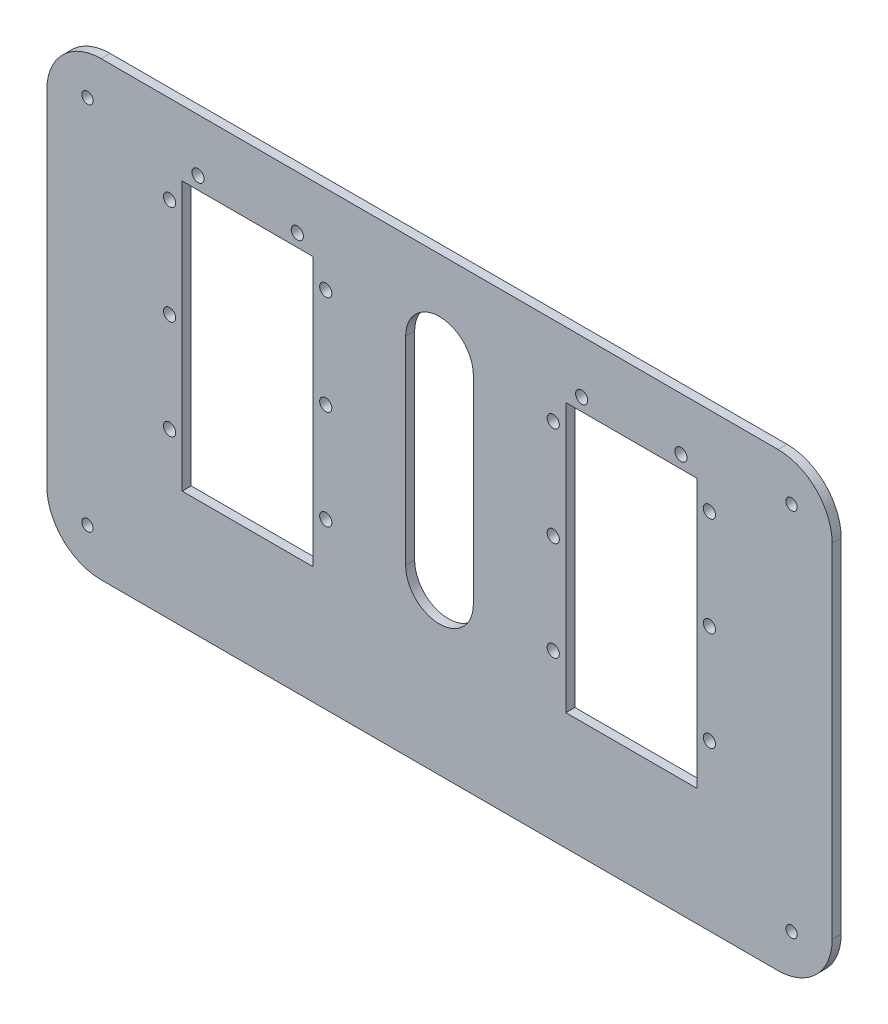
from build123d import *

# Parameters (mm, degrees)
ESBO_O1_W                     = 174
ESBO_O1_H                     = 100
ESBO_O1_R                     = 1.25
RESSALTO_EXTRUS_O1_DEPTH      = 3
FILETE1_R                     = 12
ESBO_O2_R                     = 1.35
ESBO_O2_W                     = 29
ESBO_O2_H                     = 59.5
CORTE_EXTRUS_O1_DEPTH         = 10
CONVERTER_S_LIDO1_OUTLINE_R   = 1.25
CONVERTER_S_LIDO1_OUTLINE_R_2 = 1.35
CONVERTER_S_LIDO1_OUTLINE_W   = 29
CONVERTER_S_LIDO1_OUTLINE_H   = 59.5
CONVERTER_S_LIDO1_DEPTH       = 1


# Read off the part's stored shape, not the designer's step: Converter-Sólido1
with BuildPart() as part:
    # Esboço1 → Ressalto-extrusão1 (new body)
    with BuildSketch(Plane.XY):
        Rectangle(ESBO_O1_W, ESBO_O1_H)
        with Locations((-78, -41)):
            Circle(ESBO_O1_R, mode=Mode.SUBTRACT)
        with Locations((-78, 41)):
            Circle(ESBO_O1_R, mode=Mode.SUBTRACT)
        with Locations((78, 41)):
            Circle(ESBO_O1_R, mode=Mode.SUBTRACT)
        with Locations((78, -41)):
            Circle(ESBO_O1_R, mode=Mode.SUBTRACT)
    extrude(amount=RESSALTO_EXTRUS_O1_DEPTH)

    # Filete1
    filete1_edges = [part.edges().sort_by_distance(p)[0] for p in [
        (87, -50, 1.5),
        (-87, -50, 1.5),
        (-87, 50, 1.5),
        (87, 50, 1.5),
    ]]
    fillet(filete1_edges, radius=FILETE1_R)

    # Esboço2 → Corte-extrusão1 (cut)
    with BuildSketch(Plane.XY.offset(3)):
        with Locations((-59.8, 30.5)):
            Circle(ESBO_O2_R)
        with Locations((-59.8, 8.5)):
            Circle(ESBO_O2_R)
        with Locations((-59.8, -13.5)):
            Circle(ESBO_O2_R)
        with Locations((-25.2, -13.5)):
            Circle(ESBO_O2_R)
        with Locations((-25.2, 8.5)):
            Circle(ESBO_O2_R)
        with Locations((-25.2, 30.5)):
            Circle(ESBO_O2_R)
        with Locations((-53.5, 38.3)):
            Circle(ESBO_O2_R)
        with Locations((-31.5, 38.3)):
            Circle(ESBO_O2_R)
        with Locations((31.5, 38.3)):
            Circle(ESBO_O2_R)
        with Locations((53.5, 38.3)):
            Circle(ESBO_O2_R)
        with Locations((25.2, 30.5)):
            Circle(ESBO_O2_R)
        with Locations((25.2, 8.5)):
            Circle(ESBO_O2_R)
        with Locations((25.2, -13.5)):
            Circle(ESBO_O2_R)
        with Locations((59.8, -13.5)):
            Circle(ESBO_O2_R)
        with Locations((59.8, 8.5)):
            Circle(ESBO_O2_R)
        with Locations((59.8, 30.5)):
            Circle(ESBO_O2_R)
        with Locations((-42.5, 5.75)):
            Rectangle(ESBO_O2_W, ESBO_O2_H)
        with Locations((42.5, 5.75)):
            Rectangle(ESBO_O2_W, ESBO_O2_H)
        with BuildLine():
            Line((7.5, 30.5), (7.5, -13.5))
            ThreePointArc((7.5, -13.5), (0, -21), (-7.5, -13.5))
            Line((-7.5, -13.5), (-7.5, 30.5))
            ThreePointArc((-7.5, 30.5), (0, 38), (7.5, 30.5))
        make_face()
    extrude(amount=-CORTE_EXTRUS_O1_DEPTH, mode=Mode.SUBTRACT)

    # Converter-Sólido1 outline → Converter-Sólido1 (cut)
    with BuildSketch(Plane.XY):
        with BuildLine():
            Line((87, -38), (87, 38))
            ThreePointArc((87, 38), (83.485281374, 46.485281374), (75, 50))
            Line((75, 50), (-75, 50))
            ThreePointArc((-75, 50), (-83.485281374, 46.485281374), (-87, 38))
            Line((-87, 38), (-87, -38))
            ThreePointArc((-87, -38), (-83.485281374, -46.485281374), (-75, -50))
            Line((-75, -50), (75, -50))
            ThreePointArc((75, -50), (83.485281374, -46.485281374), (87, -38))
        make_face()
        with Locations((-78, -41)):
            Circle(CONVERTER_S_LIDO1_OUTLINE_R, mode=Mode.SUBTRACT)
        with Locations((-59.8, -13.5)):
            Circle(CONVERTER_S_LIDO1_OUTLINE_R_2, mode=Mode.SUBTRACT)
        with Locations((-25.2, -13.5)):
            Circle(CONVERTER_S_LIDO1_OUTLINE_R_2, mode=Mode.SUBTRACT)
        with Locations((78, -41)):
            Circle(CONVERTER_S_LIDO1_OUTLINE_R, mode=Mode.SUBTRACT)
        with Locations((25.2, -13.5)):
            Circle(CONVERTER_S_LIDO1_OUTLINE_R_2, mode=Mode.SUBTRACT)
        with Locations((59.8, -13.5)):
            Circle(CONVERTER_S_LIDO1_OUTLINE_R_2, mode=Mode.SUBTRACT)
        with Locations((-59.8, 8.5)):
            Circle(CONVERTER_S_LIDO1_OUTLINE_R_2, mode=Mode.SUBTRACT)
        with Locations((-42.5, 5.75)):
            Rectangle(CONVERTER_S_LIDO1_OUTLINE_W, CONVERTER_S_LIDO1_OUTLINE_H, mode=Mode.SUBTRACT)
        with Locations((-25.2, 8.5)):
            Circle(CONVERTER_S_LIDO1_OUTLINE_R_2, mode=Mode.SUBTRACT)
        with Locations((-59.8, 30.5)):
            Circle(CONVERTER_S_LIDO1_OUTLINE_R_2, mode=Mode.SUBTRACT)
        with Locations((-78, 41)):
            Circle(CONVERTER_S_LIDO1_OUTLINE_R, mode=Mode.SUBTRACT)
        with Locations((-53.5, 38.3)):
            Circle(CONVERTER_S_LIDO1_OUTLINE_R_2, mode=Mode.SUBTRACT)
        with Locations((-25.2, 30.5)):
            Circle(CONVERTER_S_LIDO1_OUTLINE_R_2, mode=Mode.SUBTRACT)
        with Locations((-31.5, 38.3)):
            Circle(CONVERTER_S_LIDO1_OUTLINE_R_2, mode=Mode.SUBTRACT)
        with BuildLine():
            ThreePointArc((-7.5, 30.5), (0, 38), (7.5, 30.5))
            Line((7.5, 30.5), (7.5, -13.5))
            ThreePointArc((7.5, -13.5), (0, -21), (-7.5, -13.5))
            Line((-7.5, -13.5), (-7.5, 30.5))
        make_face(mode=Mode.SUBTRACT)
        with Locations((42.5, 5.75)):
            Rectangle(CONVERTER_S_LIDO1_OUTLINE_W, CONVERTER_S_LIDO1_OUTLINE_H, mode=Mode.SUBTRACT)
        with Locations((25.2, 8.5)):
            Circle(CONVERTER_S_LIDO1_OUTLINE_R_2, mode=Mode.SUBTRACT)
        with Locations((59.8, 8.5)):
            Circle(CONVERTER_S_LIDO1_OUTLINE_R_2, mode=Mode.SUBTRACT)
        with Locations((25.2, 30.5)):
            Circle(CONVERTER_S_LIDO1_OUTLINE_R_2, mode=Mode.SUBTRACT)
        with Locations((31.5, 38.3)):
            Circle(CONVERTER_S_LIDO1_OUTLINE_R_2, mode=Mode.SUBTRACT)
        with Locations((59.8, 30.5)):
            Circle(CONVERTER_S_LIDO1_OUTLINE_R_2, mode=Mode.SUBTRACT)
        with Locations((53.5, 38.3)):
            Circle(CONVERTER_S_LIDO1_OUTLINE_R_2, mode=Mode.SUBTRACT)
        with Locations((78, 41)):
            Circle(CONVERTER_S_LIDO1_OUTLINE_R, mode=Mode.SUBTRACT)
    extrude(amount=CONVERTER_S_LIDO1_DEPTH, mode=Mode.SUBTRACT)


solid = part.part
